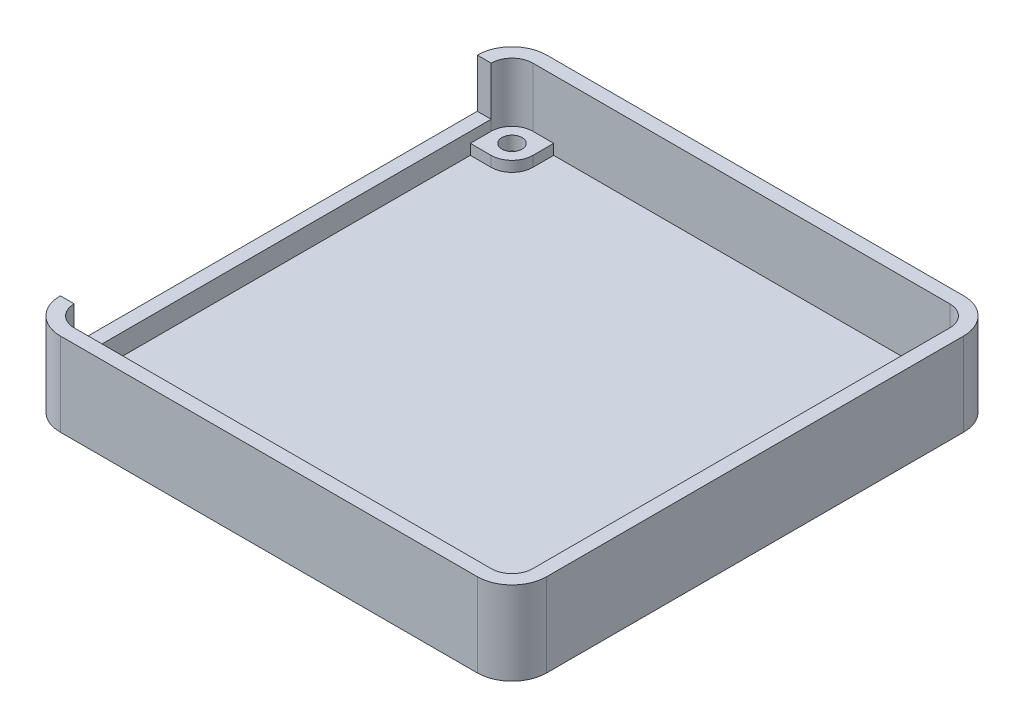
from build123d import *

# Parameters (mm, degrees)
EXTRUDE_1_DEPTH     = 2
EXTRUDE_2_DEPTH     = 10
SKETCH_3_W          = 2
SKETCH_3_H          = 60
CUT_EXTRUDE_1_DEPTH = 7
EXTRUDE_3_DEPTH     = 1.5
SKETCH_5_R          = 1.45
CUT_EXTRUDE_2_DEPTH = 2


with BuildPart() as part:
    # 草图1 → 凸台-拉伸1 (new body)
    with BuildSketch(Plane(origin=(0, 0, 0), x_dir=(1, 0, 0), z_dir=(0, 1, 0))):
        with BuildLine():
            Line((-30, -35), (30, -35))
            ThreePointArc((30, -35), (33.535533906, -33.535533906), (35, -30))
            Line((35, -30), (35, 30))
            ThreePointArc((35, 30), (33.535533906, 33.535533906), (30, 35))
            Line((30, 35), (-30, 35))
            ThreePointArc((-30, 35), (-33.535533906, 33.535533906), (-35, 30))
            Line((-35, 30), (-35, -30))
            ThreePointArc((-35, -30), (-33.535533906, -33.535533906), (-30, -35))
        make_face()
    extrude(amount=EXTRUDE_1_DEPTH)

    # 草图2 → 凸台-拉伸2 (add)
    with BuildSketch(Plane(origin=(0, 2, 0), x_dir=(1, 0, 0), z_dir=(0, 1, 0))):
        with BuildLine():
            Line((-30, -35), (30, -35))
            ThreePointArc((30, -35), (33.535533906, -33.535533906), (35, -30))
            Line((35, -30), (35, 30))
            ThreePointArc((35, 30), (33.535533906, 33.535533906), (30, 35))
            Line((30, 35), (-30, 35))
            ThreePointArc((-30, 35), (-33.535533906, 33.535533906), (-35, 30))
            Line((-35, 30), (-35, -30))
            ThreePointArc((-35, -30), (-33.535533906, -33.535533906), (-30, -35))
        make_face()
        with BuildLine():
            Line((-33, -30), (-33, 30))
            ThreePointArc((-33, 30), (-32.121320344, 32.121320344), (-30, 33))
            Line((-30, 33), (30, 33))
            ThreePointArc((30, 33), (32.121320344, 32.121320344), (33, 30))
            Line((33, 30), (33, -30))
            ThreePointArc((33, -30), (32.121320344, -32.121320344), (30, -33))
            Line((30, -33), (-30, -33))
            ThreePointArc((-30, -33), (-32.121320344, -32.121320344), (-33, -30))
        make_face(mode=Mode.SUBTRACT)
    extrude(amount=EXTRUDE_2_DEPTH)

    # 草图3 → 切除-拉伸1 (cut)
    with BuildSketch(Plane(origin=(0, 12, 0), x_dir=(1, 0, 0), z_dir=(0, 1, 0))):
        with Locations((-34, 0)):
            Rectangle(SKETCH_3_W, SKETCH_3_H)
    extrude(amount=-CUT_EXTRUDE_1_DEPTH, mode=Mode.SUBTRACT)

    # 草图4 → 凸台-拉伸3 (add)
    with BuildSketch(Plane(origin=(0, 2, 0), x_dir=(1, 0, 0), z_dir=(0, 1, 0))):
        with BuildLine():
            Line((-27, 30), (-27, 33))
            Line((-27, 33), (-30, 33))
            ThreePointArc((-30, 33), (-32.121320344, 32.121320344), (-33, 30))
            Line((-33, 30), (-33, 27))
            Line((-33, 27), (-30, 27))
            ThreePointArc((-30, 27), (-27.878679656, 27.878679656), (-27, 30))
        make_face()
        with BuildLine():
            Line((27, 30), (27, 33))
            Line((27, 33), (30, 33))
            ThreePointArc((30, 33), (32.121320344, 32.121320344), (33, 30))
            Line((33, 30), (33, 27))
            Line((33, 27), (30, 27))
            ThreePointArc((30, 27), (27.878679656, 27.878679656), (27, 30))
        make_face()
        with BuildLine():
            Line((-33, -27), (-33, -30))
            ThreePointArc((-33, -30), (-32.121320344, -32.121320344), (-30, -33))
            Line((-30, -33), (-27, -33))
            Line((-27, -33), (-27, -30))
            ThreePointArc((-27, -30), (-27.878679656, -27.878679656), (-30, -27))
            Line((-30, -27), (-33, -27))
        make_face()
        with BuildLine():
            Line((33, -30), (33, -27))
            Line((33, -27), (30, -27))
            ThreePointArc((30, -27), (27.878679656, -27.878679656), (27, -30))
            Line((27, -30), (27, -33))
            Line((27, -33), (30, -33))
            ThreePointArc((30, -33), (32.121320344, -32.121320344), (33, -30))
        make_face()
    extrude(amount=EXTRUDE_3_DEPTH)

    # 草图5 → 切除-拉伸2 (cut)
    with BuildSketch(Plane(origin=(0, 3.5, 0), x_dir=(1, 0, 0), z_dir=(0, 1, 0))):
        with Locations((30, -30)):
            Circle(SKETCH_5_R)
        with Locations((30, 30)):
            Circle(SKETCH_5_R)
        with Locations((-30, 30)):
            Circle(SKETCH_5_R)
        with Locations((-30, -30)):
            Circle(SKETCH_5_R)
    extrude(amount=-CUT_EXTRUDE_2_DEPTH, mode=Mode.SUBTRACT)


solid = part.part
